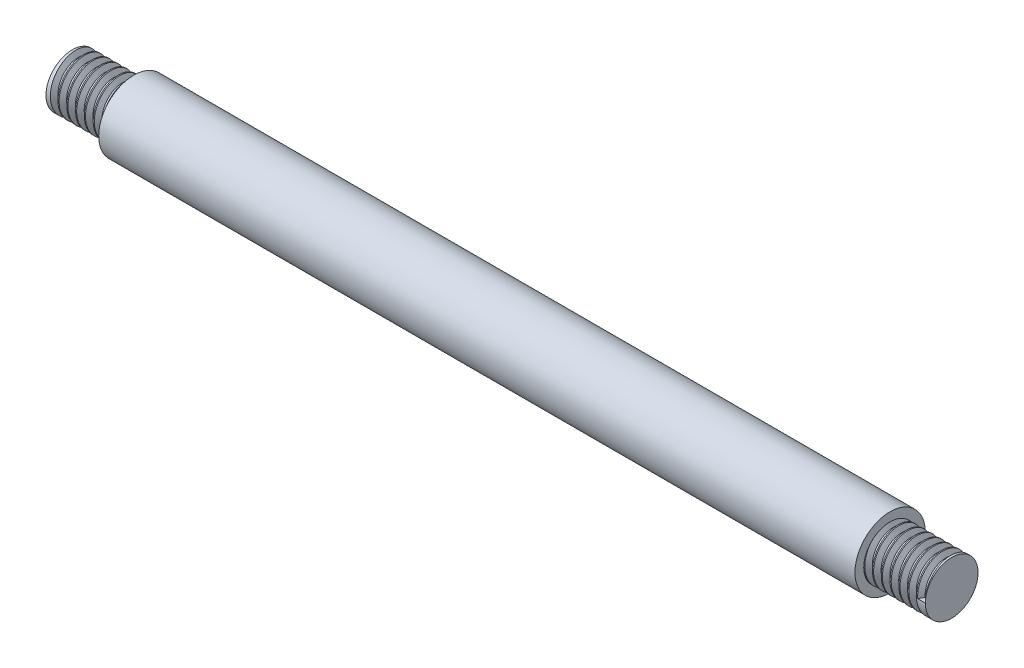
from build123d import *

# Parameters (mm, degrees)
SKETCH1_W     = 100
SKETCH1_H     = 3
SKETCH1_W_2   = 86
SKETCH1_H_2   = 1
THREAD2_PITCH = 1
THREAD3_PITCH = 1


with BuildPart() as part:
    # Sketch1 → Revolve2 (revolve)
    with BuildSketch(Plane(origin=(0, 0, 0), x_dir=(1, 0, 0), z_dir=(0, 1, 0)), mode=Mode.PRIVATE) as revolve2_sk:
        Rectangle(SKETCH1_W, SKETCH1_H)
        with Locations((0, 2)):
            Rectangle(SKETCH1_W_2, SKETCH1_H_2)
    revolve(revolve2_sk.sketch.rotate(Axis((-50, 0, 1.5), (1, 0, 0)), 180), axis=Axis((-50, 0, 1.5), (1, 0, 0)))

    # Thread2: the profile of Thread Profile2 profile screwed along a right-hand helix of 7 turns, 8 arcs to a turn; built about Z, then put on its axis
    thread2_z = Axis((0, 0, 0), (0, 0, 1))
    thread2_corners = [(3.0003, 0, -0.000173205), (3.0003, 0, 0.875173202), (2.458734125, 0, 0.562499999), (2.458734125, 0, 0.312499999)]
    with BuildLine(mode=Mode.PRIVATE) as thread2_profile:
        Line(thread2_corners[0], thread2_corners[1])
        Line(thread2_corners[1], thread2_corners[2])
        Line(thread2_corners[2], thread2_corners[3])
        Line(thread2_corners[3], thread2_corners[0])
    thread2_cap = Face(thread2_profile.wire())
    thread2_turn_angles = [0, 22.5, 45, 67.5, 90, 112.5, 135, 157.5, 180, 202.5, 225, 247.5, 270, 292.5, 315, 337.5, 360]
    thread2_turn_weights = [1, 0.9238795325112867, 1, 0.9238795325112867, 1, 0.9238795325112867, 1, 0.9238795325112867, 1, 0.9238795325112867, 1, 0.9238795325112867, 1, 0.9238795325112867, 1, 0.9238795325112867, 1]
    thread2_turn_rails = [Edge.make_bspline([Vector(p[0], p[1], 0).rotate(thread2_z, thread2_turn_angles[k]) / thread2_turn_weights[k] + Vector(0, 0, p[2] + THREAD2_PITCH * thread2_turn_angles[k] / 360) for k in range(17)], [0, 0, 0, 1, 1, 2, 2, 3, 3, 4, 4, 5, 5, 6, 6, 7, 7, 8, 8, 8], 2, thread2_turn_weights) for p in thread2_corners]
    thread2_turn_sides = [Face.make_surface_from_curves(thread2_turn_rails[p[0]], thread2_turn_rails[p[1]]) for p in [(0, 1), (1, 2), (2, 3), (3, 0)]]
    thread2 = Plane(origin=(-50, 0, 1.5), x_dir=(0, 0, -1), z_dir=(1, 0, 0)) * Solid(Shell([*[p.moved(Location((0, 0, THREAD2_PITCH * i))) for i in range(7) for p in thread2_turn_sides], thread2_cap, thread2_cap.rotate(thread2_z, 2520).moved(Location((0, 0, THREAD2_PITCH * 2520 / 360)))]))
    add(thread2, mode=Mode.SUBTRACT)

    # Thread3: the profile of Thread Profile3 profile screwed along a right-hand helix of 7 turns, 8 arcs to a turn; built about Z, then put on its axis
    thread3_z = Axis((0, 0, 0), (0, 0, 1))
    thread3_corners = [(3.0003, 0, -0.000173205), (3.0003, 0, 0.875173202), (2.458734125, 0, 0.562499999), (2.458734125, 0, 0.312499999)]
    with BuildLine(mode=Mode.PRIVATE) as thread3_profile:
        Line(thread3_corners[0], thread3_corners[1])
        Line(thread3_corners[1], thread3_corners[2])
        Line(thread3_corners[2], thread3_corners[3])
        Line(thread3_corners[3], thread3_corners[0])
    thread3_cap = Face(thread3_profile.wire())
    thread3_turn_angles = [0, 22.5, 45, 67.5, 90, 112.5, 135, 157.5, 180, 202.5, 225, 247.5, 270, 292.5, 315, 337.5, 360]
    thread3_turn_weights = [1, 0.9238795325112867, 1, 0.9238795325112867, 1, 0.9238795325112867, 1, 0.9238795325112867, 1, 0.9238795325112867, 1, 0.9238795325112867, 1, 0.9238795325112867, 1, 0.9238795325112867, 1]
    thread3_turn_rails = [Edge.make_bspline([Vector(p[0], p[1], 0).rotate(thread3_z, thread3_turn_angles[k]) / thread3_turn_weights[k] + Vector(0, 0, p[2] + THREAD3_PITCH * thread3_turn_angles[k] / 360) for k in range(17)], [0, 0, 0, 1, 1, 2, 2, 3, 3, 4, 4, 5, 5, 6, 6, 7, 7, 8, 8, 8], 2, thread3_turn_weights) for p in thread3_corners]
    thread3_turn_sides = [Face.make_surface_from_curves(thread3_turn_rails[p[0]], thread3_turn_rails[p[1]]) for p in [(0, 1), (1, 2), (2, 3), (3, 0)]]
    thread3 = Plane(origin=(50, 0, 1.5), x_dir=(0, 0, 1), z_dir=(-1, 0, 0)) * Solid(Shell([*[p.moved(Location((0, 0, THREAD3_PITCH * i))) for i in range(7) for p in thread3_turn_sides], thread3_cap, thread3_cap.rotate(thread3_z, 2520).moved(Location((0, 0, THREAD3_PITCH * 2520 / 360)))]))
    add(thread3, mode=Mode.SUBTRACT)


solid = part.part
